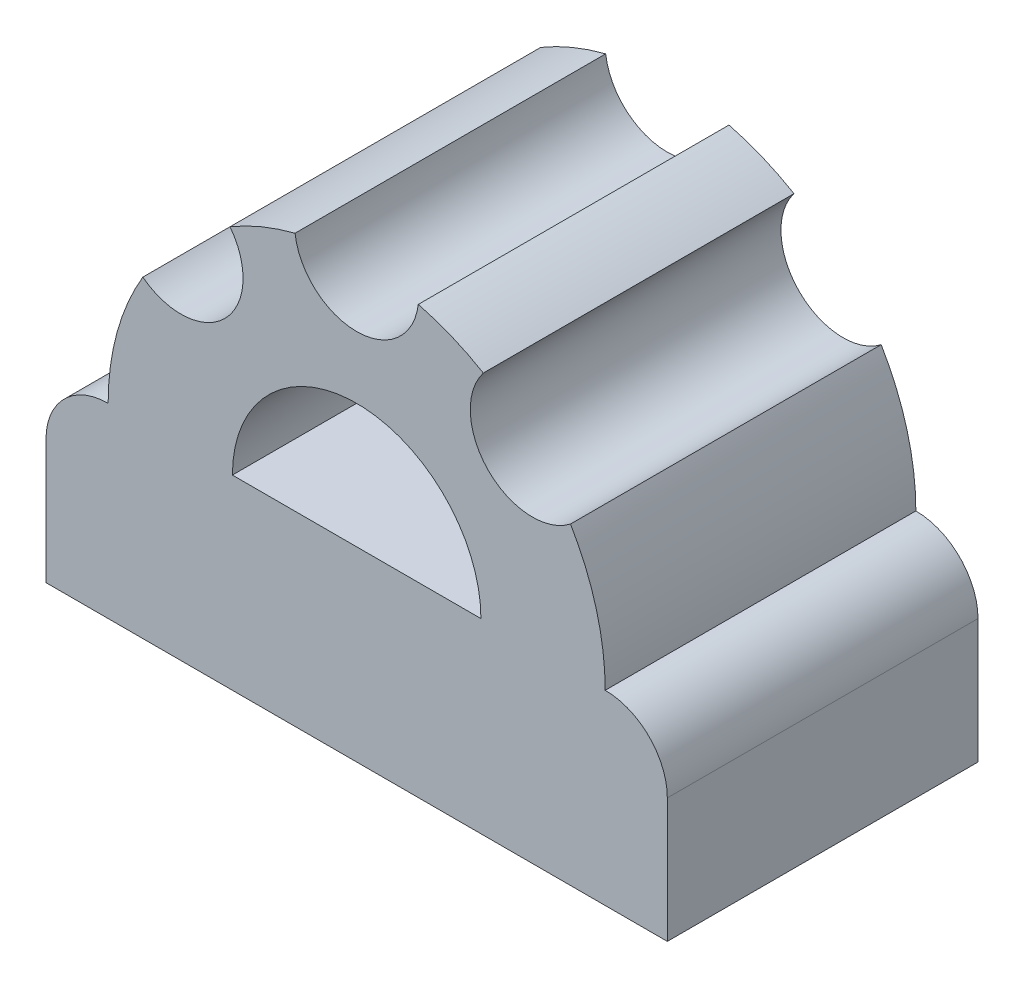
from build123d import *

# Parameters (mm, degrees)
BOSS_EXTRUDE1_DEPTH = 5
SKETCH2_R           = 1
CUT_EXTRUDE1_DEPTH  = 5
FILLET1_R           = 1


with BuildPart() as part:
    # Sketch1 → Boss-Extrude1 (new body)
    with BuildSketch(Plane.XY):
        with BuildLine():
            Line((0, 0), (0, 3))
            Line((0, 3), (-1, 3))
            ThreePointArc((-1, 3), (-5, 7), (-9, 3))
            Line((-9, 3), (-10, 3))
            Line((-10, 3), (-10, 0))
            Line((-10, 0), (0, 0))
        make_face()
        with BuildLine():
            ThreePointArc((-7, 3), (-5, 5), (-3, 3))
            Line((-3, 3), (-7, 3))
        make_face(mode=Mode.SUBTRACT)
    extrude(amount=BOSS_EXTRUDE1_DEPTH)

    # Sketch2 → Cut-Extrude1 (cut)
    with BuildSketch(Plane.XY.offset(5)):
        with Locations((-5, 7)):
            Circle(SKETCH2_R)
        with Locations((-2.171572875, 5.828427125)):
            Circle(SKETCH2_R)
        with Locations((-7.828427125, 5.828427125)):
            Circle(SKETCH2_R)
    extrude(amount=-CUT_EXTRUDE1_DEPTH, mode=Mode.SUBTRACT)

    # Fillet1
    fillet1_edges = [part.edges().sort_by_distance(p)[0] for p in [
        (0, 3, 2.5),
        (-10, 3, 2.5),
    ]]
    fillet(fillet1_edges, radius=FILLET1_R - 0.0001)  # a hair under: the kernel refuses the full size


solid = part.part
